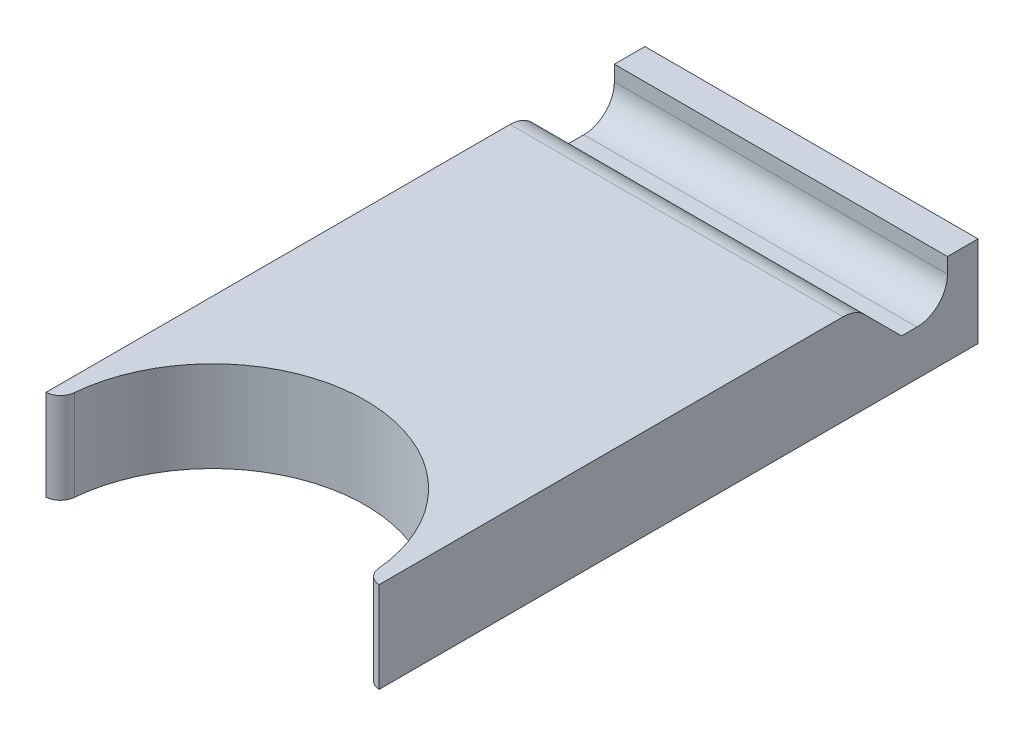
from build123d import *

# Parameters (mm, degrees)
BOSS_EXTRUDE1_DEPTH = 2.97
FILLET1_R           = 0.5
SKETCH2_W           = 10.9
SKETCH2_H           = 1
CUT_EXTRUDE1_DEPTH  = 1.5
CHAMFER1_SIZE       = 2
FILLET2_R           = 1


with BuildPart() as part:
    # Sketch1 → Boss-Extrude1 (new body)
    with BuildSketch(Plane(origin=(0, 0, 0), x_dir=(1, 0, 0), z_dir=(0, 1, 0))):
        with BuildLine():
            Line((5, 0), (5.45, 0))
            Line((5.45, 0), (5.45, 19.6))
            Line((5.45, 19.6), (-5.45, 19.6))
            Line((-5.45, 19.6), (-5.45, 0))
            Line((-5.45, 0), (-5, 0))
            ThreePointArc((-5, 0), (0, 5), (5, 0))
        make_face()
    extrude(amount=BOSS_EXTRUDE1_DEPTH)

    # Fillet1
    # the kernel refuses this fillet: 0.5 mm, written as the material it takes off along each edge
    with BuildSketch(Plane(origin=(5, -1.193063938, 0), x_dir=(1, 0, 0), z_dir=(0, 1, 0))) as fillet1_piece_1:
        with BuildLine():
            CenterArc((0.477225575, 0.5), FILLET1_R, 185.21590857, 84.78409143)
            ThreePointArc((-0.020704023, 0.454545455), (-0.005178688, 0.227508366), (0, 0))
            Line((0, 0), (0.477225575, 0))
        make_face()
    extrude(amount=5.356127875, mode=Mode.SUBTRACT)
    with BuildSketch(Plane(origin=(-5, -1.193063938, 0), x_dir=(-1, 0, 0), z_dir=(0, 1, 0))) as fillet1_piece_2:
        with BuildLine():
            CenterArc((0.477225575, -0.5), FILLET1_R, 90, 84.78409143)
            ThreePointArc((-0.020704023, -0.454545455), (-0.005178688, -0.227508366), (0, 0))
            Line((0, 0), (0.477225575, 0))
        make_face()
    extrude(amount=5.356127875, mode=Mode.SUBTRACT)

    # Sketch2 → Cut-Extrude1 (cut)
    with BuildSketch(Plane(origin=(0, 2.97, 0), x_dir=(1, 0, 0), z_dir=(0, 1, 0))):
        with Locations((0, 18.1)):
            Rectangle(SKETCH2_W, SKETCH2_H)
    extrude(amount=-CUT_EXTRUDE1_DEPTH, mode=Mode.SUBTRACT)

    # Chamfer1
    # the kernel refuses this chamfer: 2 mm, written as the material it takes off along each edge
    with BuildSketch(Plane(origin=(10.593365976, 2.97, -17.6), x_dir=(0, 0.02749587661058627, 0.9996219169112968), z_dir=(-1, 0, 0))) as chamfer1_piece_1_section:
        Polygon((CHAMFER1_SIZE * 0.999621916911, -CHAMFER1_SIZE * 0.0274958766106), (-CHAMFER1_SIZE * 0.0274958766106, -CHAMFER1_SIZE * 0.999621916911), (0, 0), align=None)
    chamfer1_piece_1 = extrude(amount=21.186731952, mode=Mode.PRIVATE)
    chamfer1_piece_1 = split(chamfer1_piece_1, bisect_by=Plane(origin=(0, 1.47, -16.89608178), z_dir=(0, 1, 0)), keep=Keep.TOP, mode=Mode.PRIVATE)
    add(chamfer1_piece_1, mode=Mode.SUBTRACT)

    # Fillet2
    fillet2_edges = [part.edges().sort_by_distance(p)[0] for p in [
        (0, 1.47, -18.6),
        (0, 2.97, -15.6),
    ]]
    fillet(fillet2_edges, radius=FILLET2_R)


solid = part.part
